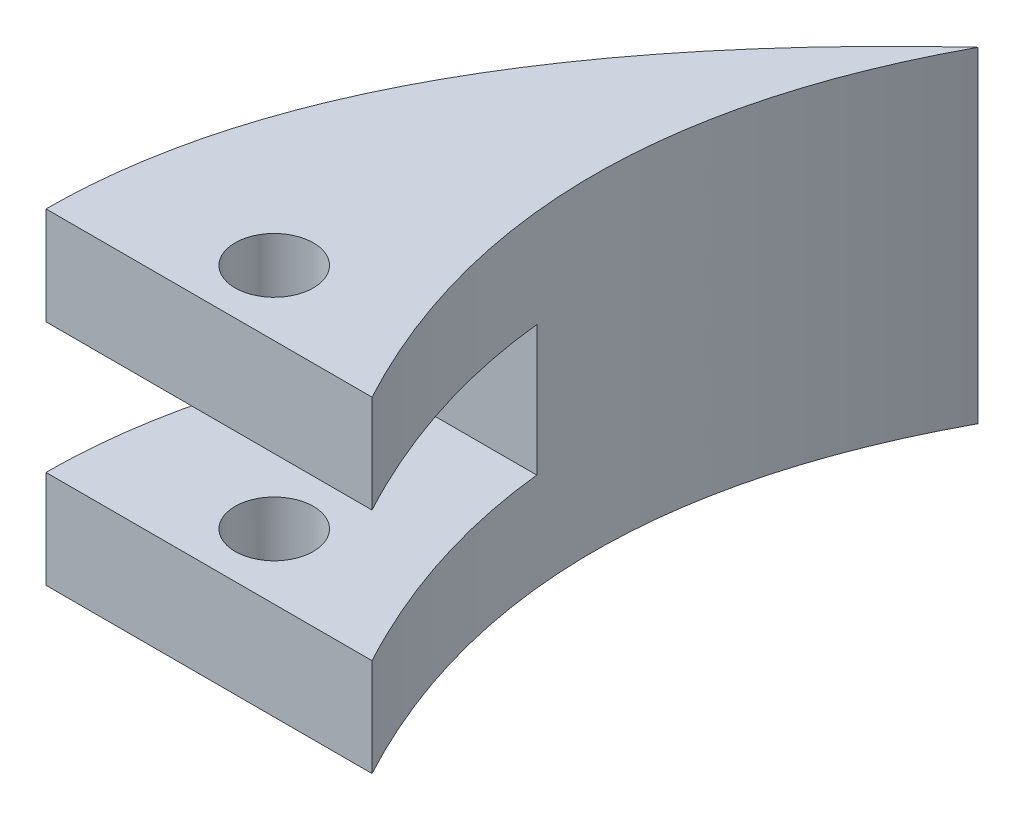
from build123d import *

# Parameters (mm, degrees)
SKETCH_1_W          = 25
SKETCH_1_H          = 25
EXTRUDE_1_DEPTH     = 46.469893975
SKETCH_2_R          = 3
CUT_EXTRUDE_1_DEPTH = 36.344532851
SKETCH_4_W          = 25
SKETCH_4_H          = 10
CUT_EXTRUDE_2_DEPTH = 18.639834826
SKETCH_6_OUTSIDE_W  = 38.678
SKETCH_6_OUTSIDE_H  = 60.148
CUT_EXTRUDE_4_DEPTH = 43


with BuildPart() as part:
    # 스케치1 → 보스-돌출1 (new body)
    with BuildSketch(Plane.XY):
        Rectangle(SKETCH_1_W, SKETCH_1_H)
    extrude(amount=EXTRUDE_1_DEPTH)

    # 스케치2 → 컷-돌출1 (cut)
    with BuildSketch(Plane(origin=(0, 12.5, 0), x_dir=(1, 0, 0), z_dir=(0, 1, 0))):
        with Locations((0, -41.469893975)):
            Circle(SKETCH_2_R)
    extrude(amount=-CUT_EXTRUDE_1_DEPTH, mode=Mode.SUBTRACT)

    # 스케치4 → 컷-돌출2 (cut)
    with BuildSketch(Plane.XY.offset(46.469893975)):
        Rectangle(SKETCH_4_W, SKETCH_4_H)
    extrude(amount=-CUT_EXTRUDE_2_DEPTH, mode=Mode.SUBTRACT)

    # 스케치6 outside → 컷-돌출4 (cut)
    with BuildSketch(Plane(origin=(0, 12.5, 0), x_dir=(1, 0, 0), z_dir=(0, 1, 0))):
        with Locations((0, -23.235)):
            Rectangle(SKETCH_6_OUTSIDE_W, SKETCH_6_OUTSIDE_H)
        with BuildLine():
            Line((12.5, -46.469893975), (-12.5, -46.469893975))
            add(Edge.make_bspline(
                [(12.5, 0), (-12.5, -23.234946987), (-12.5, -46.469893975)],
                knots=[0, 0, 0, 1, 1, 1], degree=2))
            add(Edge.make_bspline(
                [(12.5, 0), (0, -23.234946987), (12.5, -46.469893975)],
                knots=[0, 0, 0, 1, 1, 1], degree=2))
        make_face(mode=Mode.SUBTRACT)
    extrude(amount=-CUT_EXTRUDE_4_DEPTH, mode=Mode.SUBTRACT)


solid = part.part
